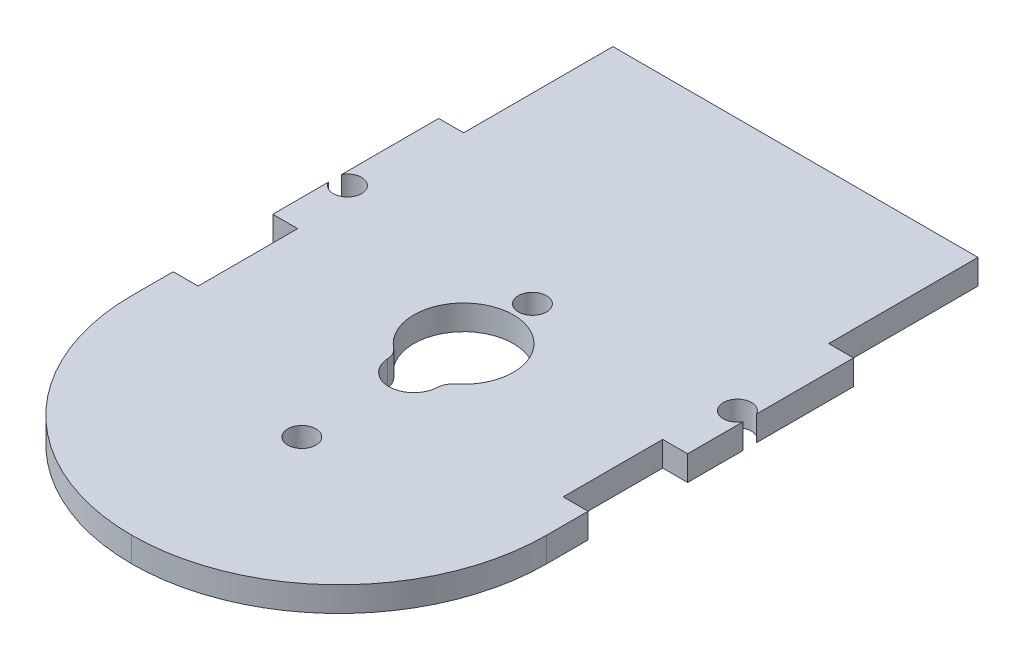
from build123d import *

# Parameters (mm, degrees)
SKETCH2_W                = 50
SKETCH2_H                = 80
BOSS_EXTRUDE1_DEPTH      = 3
M4_CLEARANCE_HOLE1_D     = 4.5
M4_CLEARANCE_HOLE1_DEPTH = 3
M4_CLEARANCE_HOLE1_TIP   = 1.351936393
SKETCH5_R                = 6
CUT_EXTRUDE1_DEPTH       = 3
SKETCH6_R                = 3
CUT_EXTRUDE2_DEPTH       = 3
FILLET1_R                = 2
FILLET2_R                = 25
SKETCH7_W                = 3
SKETCH7_H                = 18
SKETCH7_H_2              = 12
CUT_EXTRUDE3_DEPTH       = 3
M3_CLEARANCE_HOLE1_D     = 3.4
M3_CLEARANCE_HOLE1_DEPTH = 3
M3_CLEARANCE_HOLE1_TIP   = 1.021463052
M3_CLEARANCE_HOLE2_D     = 3.4


with BuildPart() as part:
    # Sketch2 → Boss-Extrude1 (new body)
    with BuildSketch(Plane(origin=(0, 0, 0), x_dir=(1, 0, 0), z_dir=(0, 1, 0))):
        with Locations((25, 40)):
            Rectangle(SKETCH2_W, SKETCH2_H)
    extrude(amount=BOSS_EXTRUDE1_DEPTH)

    # M4 Clearance Hole1
    with Locations(Plane(origin=(0, 3, 0), x_dir=(1, 0, 0), z_dir=(0, 1, 0))):
        with Locations((25, 40)):
            Hole(M4_CLEARANCE_HOLE1_D / 2, depth=M4_CLEARANCE_HOLE1_DEPTH)
            with Locations((0, 0, -(M4_CLEARANCE_HOLE1_DEPTH + M4_CLEARANCE_HOLE1_TIP / 2))):  # 118° drill point
                Cone(0, M4_CLEARANCE_HOLE1_D / 2, M4_CLEARANCE_HOLE1_TIP, mode=Mode.SUBTRACT)

    # Sketch5 → Cut-Extrude1 (cut)
    with BuildSketch(Plane(origin=(0, 3, 0), x_dir=(1, 0, 0), z_dir=(0, 1, 0))):
        with Locations(Location((25, 40, 0), (0, 0, 270))):
            Circle(SKETCH5_R)
    extrude(amount=-CUT_EXTRUDE1_DEPTH, mode=Mode.SUBTRACT)

    # Sketch6 → Cut-Extrude2 (cut)
    with BuildSketch(Plane(origin=(0, 3, 0), x_dir=(1, 0, 0), z_dir=(0, 1, 0))):
        with Locations((25, 34)):
            Circle(SKETCH6_R)
    extrude(amount=-CUT_EXTRUDE2_DEPTH, mode=Mode.SUBTRACT)

    # Fillet1
    fillet1_edges = [part.edges().sort_by_distance(p)[0] for p in [
        (22.09526249, 1.5, -34.75),
        (27.90473751, 1.5, -34.75),
    ]]
    fillet(fillet1_edges, radius=FILLET1_R)

    # Fillet2
    fillet2_edges = [part.edges().sort_by_distance(p)[0] for p in [
        (0, 1.5, 0),
        (50, 1.5, 0),
    ]]
    fillet(fillet2_edges, radius=FILLET2_R - 0.0001)  # a hair under: the kernel refuses the full size

    # Sketch7 → Cut-Extrude3 (cut)
    with BuildSketch(Plane(origin=(0, 3, 0), x_dir=(1, 0, 0), z_dir=(0, 1, 0))):
        with Locations((48.5, 71)):
            Rectangle(SKETCH7_W, SKETCH7_H)
        with Locations((1.5, 71)):
            Rectangle(SKETCH7_W, SKETCH7_H)
        with Locations((48.5, 36)):
            Rectangle(SKETCH7_W, SKETCH7_H_2)
        with Locations((1.5, 36)):
            Rectangle(SKETCH7_W, SKETCH7_H_2)
    extrude(amount=-CUT_EXTRUDE3_DEPTH, mode=Mode.SUBTRACT)

    # M3 Clearance Hole1
    with Locations(Plane(origin=(0, 3, 0), x_dir=(1, 0, 0), z_dir=(0, 1, 0))):
        with Locations((25, 48.3), (25, 20.5)):
            Hole(M3_CLEARANCE_HOLE1_D / 2, depth=M3_CLEARANCE_HOLE1_DEPTH)
            with Locations((0, 0, -(M3_CLEARANCE_HOLE1_DEPTH + M3_CLEARANCE_HOLE1_TIP / 2))):  # 118° drill point
                Cone(0, M3_CLEARANCE_HOLE1_D / 2, M3_CLEARANCE_HOLE1_TIP, mode=Mode.SUBTRACT)

    # M3 Clearance Hole2 (through all)
    with Locations(Plane(origin=(0, 3, 0), x_dir=(1, 0, 0), z_dir=(0, 1, 0))):
        with Locations((1.5, 49.5), (48.5, 49.5)):
            Hole(M3_CLEARANCE_HOLE2_D / 2)


solid = part.part
